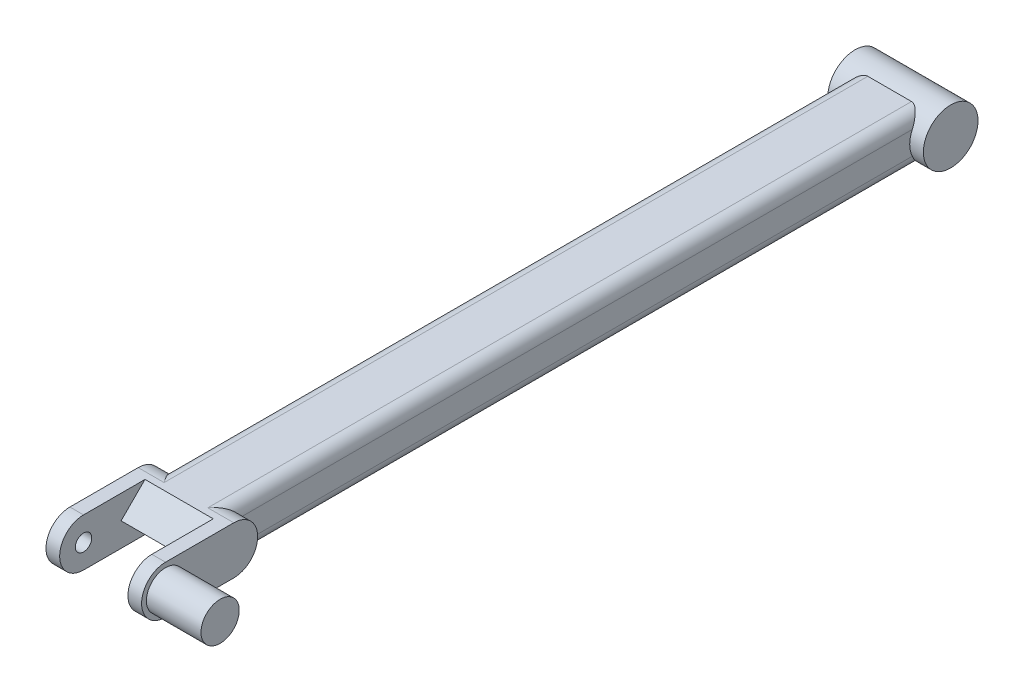
from build123d import *

# Parameters (mm, degrees)
AUFSATZ_LINEAR_AUSTRAGEN1_DEPTH      = 35
AUFSATZ_LINEAR_AUSTRAGEN1_DEPTH_BACK = 35
SKIZZE1_R                            = 20
SKIZZE2_W                            = 50
SKIZZE2_H                            = 35
AUFSATZ_LINEAR_AUSTRAGEN2_DEPTH      = 550
AUFSATZ_LINEAR_AUSTRAGEN3_DEPTH      = 10
SCHNITT_LINEAR_AUSTRAGEN1_REACH      = 598.956
SKIZZE4_R                            = 6
SKIZZE5_R                            = 14
AUFSATZ_LINEAR_AUSTRAGEN4_DEPTH      = 40
VERRUNDUNG1_R                        = 9
FASE2_SIZE                           = 20


with BuildPart() as part:
    # Skizze1 → Aufsatz-Linear austragen1 (new, two sides: drawn at the far end of the back side and taken through both)
    with BuildSketch(Plane(origin=(0, 0, 0), x_dir=(0, 0, -1), z_dir=(1, 0, 0)).offset(-AUFSATZ_LINEAR_AUSTRAGEN1_DEPTH_BACK)):
        Circle(SKIZZE1_R)
    extrude(amount=AUFSATZ_LINEAR_AUSTRAGEN1_DEPTH + AUFSATZ_LINEAR_AUSTRAGEN1_DEPTH_BACK)

    # Skizze2 → Aufsatz-Linear austragen2 (add)
    with BuildSketch(Plane.XY):
        Rectangle(SKIZZE2_W, SKIZZE2_H)
    extrude(amount=AUFSATZ_LINEAR_AUSTRAGEN2_DEPTH)

    # Skizze3 → Aufsatz-Linear austragen3 (add)
    with BuildSketch(Plane.ZY.offset(25)):
        with BuildLine():
            Line((550, 17.5), (525, 17.5))
            ThreePointArc((525, 17.5), (507.5, 0), (525, -17.5))
            Line((525, -17.5), (550, -17.5))
            Line((550, -17.5), (575, -17.5))
            ThreePointArc((575, -17.5), (592.5, 0), (575, 17.5))
            Line((575, 17.5), (550, 17.5))
        make_face()
    aufsatz_linear_austragen3 = extrude(amount=AUFSATZ_LINEAR_AUSTRAGEN3_DEPTH)

    # Skizze4 → Schnitt-Linear austragen1 (cut, up to next)
    with BuildSketch(Plane.ZY.offset(35), mode=Mode.PRIVATE) as schnitt_linear_austragen1_sk1:
        with Locations(Location((575, 0, 0), (0, 0, 270))):
            Circle(SKIZZE4_R)
    schnitt_linear_austragen1_tool1 = extrude(schnitt_linear_austragen1_sk1.sketch, amount=-SCHNITT_LINEAR_AUSTRAGEN1_REACH, mode=Mode.PRIVATE) & part.part
    schnitt_linear_austragen1 = schnitt_linear_austragen1_tool1.solids().sort_by_distance((-35, 0, 575))[0]
    add(schnitt_linear_austragen1, mode=Mode.SUBTRACT)

    # Spiegeln1: Aufsatz-Linear austragen3, Schnitt-Linear austragen1 across plane
    add(aufsatz_linear_austragen3.mirror(Plane(origin=(0, 0, 0), x_dir=(0, 0, 1), z_dir=(1, 0, 0))))
    add(schnitt_linear_austragen1.mirror(Plane(origin=(0, 0, 0), x_dir=(0, 0, 1), z_dir=(1, 0, 0))), mode=Mode.SUBTRACT)

    # Skizze5 → Aufsatz-Linear austragen4 (add)
    with BuildSketch(Plane(origin=(35, 0, 0), x_dir=(0, 0, -1), z_dir=(1, 0, 0))):
        with Locations(Location((-575, 0, 0), (0, 0, 90))):
            Circle(SKIZZE5_R)
    extrude(amount=AUFSATZ_LINEAR_AUSTRAGEN4_DEPTH)

    # Verrundung1
    verrundung1_edges = [part.edges().sort_by_distance(p)[0] for p in [
        (-25, 17.5, 267.341229183),
        (-25, -17.5, 267.341229183),
        (25, 17.5, 267.341229183),
        (25, -17.5, 267.341229183),
    ]]
    fillet(verrundung1_edges, radius=VERRUNDUNG1_R)

    # Fase2
    # the kernel refuses this chamfer: 20 mm, written as the material it takes off along each edge
    with BuildSketch(Plane(origin=(25, -17.5, 550), x_dir=(0, -0.027495876610586282, -0.9996219169112968), z_dir=(-1, 0, 0))) as fase2_piece_1:
        Polygon((FASE2_SIZE * 0.999621916911, -FASE2_SIZE * 0.0274958766106), (-FASE2_SIZE * 0.0274958766106, -FASE2_SIZE * 0.999621916911), (0, 0), align=None)
    extrude(amount=50, mode=Mode.SUBTRACT)
    with BuildSketch(Plane(origin=(-25, 17.5, 550), x_dir=(0, -0.9996219169112968, 0.0274958766105877), z_dir=(1, 0, 0))) as fase2_piece_2:
        Polygon((FASE2_SIZE * 0.999621916911, FASE2_SIZE * 0.0274958766106), (-FASE2_SIZE * 0.0274958766106, FASE2_SIZE * 0.999621916911), (0, 0), align=None)
    extrude(amount=50, mode=Mode.SUBTRACT)


solid = part.part
